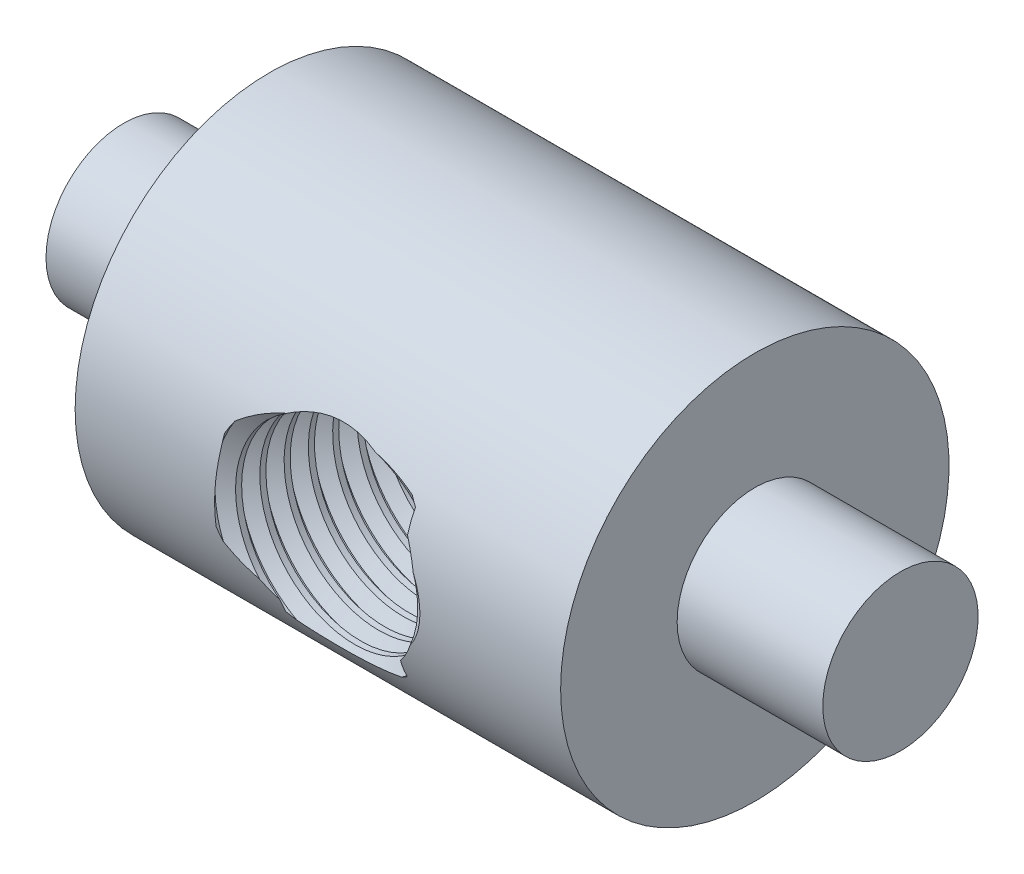
from build123d import *

# Parameters (mm, degrees)
SKETCH1_R          = 10
MAIN_DEPTH         = 40
SKETCH2_R          = 10
SKETCH2_R_2        = 4
CAP_REMOVE_1_DEPTH = 7.5
CAP_START          = 7.5
SKETCH3_R          = 10
SKETCH3_R_2        = 4
CAP_REMOVE_2_DEPTH = 7.5
M10HOLE_DEPTH      = 54.649997606
M10HOLE_DEPTH_BACK = 54.649997606
SKETCH4_R          = 5
THREAD1_PITCH      = 1.25


with BuildPart() as part:
    # Sketch1 → Main (new body)
    with BuildSketch(Plane(origin=(0, 0, 0), x_dir=(0, 0, -1), z_dir=(1, 0, 0))):
        with Locations((-15.140094082, 15.422389987)):
            Circle(SKETCH1_R)
    extrude(amount=MAIN_DEPTH)

    # Sketch2 → Cap Remove 1 (cut)
    with BuildSketch(Plane.ZY):
        with Locations((15.140094082, 15.422389987)):
            Circle(SKETCH2_R)
        with Locations((15.140094082, 15.422389987)):
            Circle(SKETCH2_R_2, mode=Mode.SUBTRACT)
    extrude(amount=-CAP_REMOVE_1_DEPTH, mode=Mode.SUBTRACT)

    # Sketch3 → Cap Remove 2 (cut)
    with BuildSketch(Plane(origin=(40, 0, -40), x_dir=(0, 0, 1), z_dir=(-1, 0, 0)).offset(CAP_START)):
        with Locations((55.140094082, 15.422389987)):
            Circle(SKETCH3_R)
        with Locations((55.140094082, 15.422389987)):
            Circle(SKETCH3_R_2, mode=Mode.SUBTRACT)
    extrude(amount=-CAP_REMOVE_2_DEPTH, mode=Mode.SUBTRACT)

    # Sketch4 → M10Hole (cut, two sides: drawn at the far end of the back side and taken through both)
    with BuildSketch(Plane.XY.offset(-M10HOLE_DEPTH_BACK)):
        with Locations(Location((20, 15.422389987, 0), (0, 0, 180))):
            Circle(SKETCH4_R)
    extrude(amount=M10HOLE_DEPTH + M10HOLE_DEPTH_BACK, mode=Mode.SUBTRACT)

    # Thread1: the profile of Thread Profile1 profile screwed along a right-hand helix of 24 turns, 8 arcs to a turn; built about Z, then put on its axis
    thread1_z = Axis((0, 0, 0), (0, 0, 1))
    thread1_corners = [(4.9997, 0, -0.000173205), (5.676582344, 0, 0.390624998), (5.676582344, 0, 0.546874998), (4.9997, 0, 0.937673202)]
    with BuildLine(mode=Mode.PRIVATE) as thread1_profile:
        Line(thread1_corners[0], thread1_corners[1])
        Line(thread1_corners[1], thread1_corners[2])
        Line(thread1_corners[2], thread1_corners[3])
        Line(thread1_corners[3], thread1_corners[0])
    thread1_cap = Face(thread1_profile.wire())
    thread1_turn_angles = [0, 22.5, 45, 67.5, 90, 112.5, 135, 157.5, 180, 202.5, 225, 247.5, 270, 292.5, 315, 337.5, 360]
    thread1_turn_weights = [1, 0.9238795325112867, 1, 0.9238795325112867, 1, 0.9238795325112867, 1, 0.9238795325112867, 1, 0.9238795325112867, 1, 0.9238795325112867, 1, 0.9238795325112867, 1, 0.9238795325112867, 1]
    thread1_turn_rails = [Edge.make_bspline([Vector(p[0], p[1], 0).rotate(thread1_z, thread1_turn_angles[k]) / thread1_turn_weights[k] + Vector(0, 0, p[2] + THREAD1_PITCH * thread1_turn_angles[k] / 360) for k in range(17)], [0, 0, 0, 1, 1, 2, 2, 3, 3, 4, 4, 5, 5, 6, 6, 7, 7, 8, 8, 8], 2, thread1_turn_weights) for p in thread1_corners]
    thread1_turn_sides = [Face.make_surface_from_curves(thread1_turn_rails[p[0]], thread1_turn_rails[p[1]]) for p in [(0, 1), (1, 2), (2, 3), (3, 0)]]
    thread1 = Plane(origin=(20, 15.422389987, 0), x_dir=(1, 0, 0), z_dir=(0, 0, 1)) * Solid(Shell([*[p.moved(Location((0, 0, THREAD1_PITCH * i))) for i in range(24) for p in thread1_turn_sides], thread1_cap, thread1_cap.rotate(thread1_z, 8640).moved(Location((0, 0, THREAD1_PITCH * 8640 / 360)))]))
    add(thread1, mode=Mode.SUBTRACT)


solid = part.part
